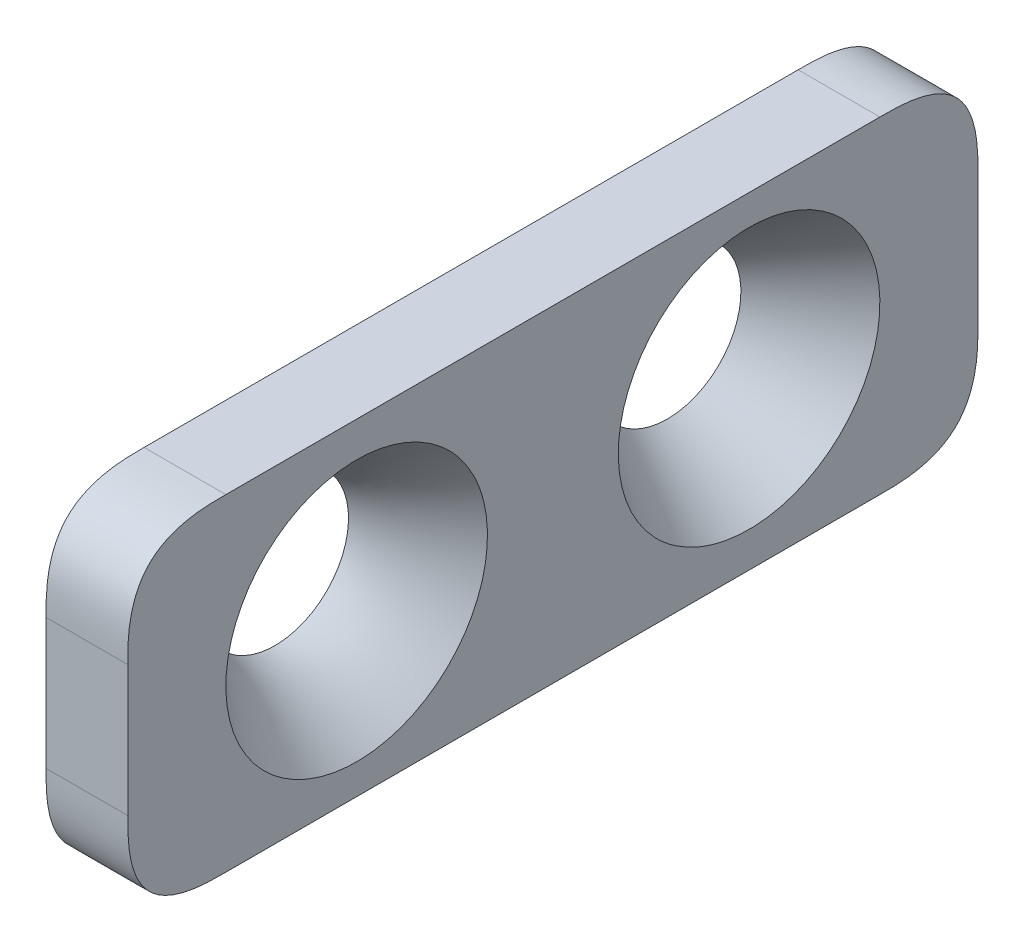
from build123d import *

# Parameters (mm, degrees)
SKETCH1_W           = 26
SKETCH1_H           = 10
BOSS_EXTRUDE1_DEPTH = 2.5
FILLET1_SIZE        = 3
SKETCH4_5_R         = 2.25
SKETCH3_6_R         = 4


with BuildPart() as part:
    # Sketch1 → Boss-Extrude1 (new body)
    with BuildSketch(Plane(origin=(0, 0, 0), x_dir=(0, 0, -1), z_dir=(1, 0, 0))):
        with Locations((13, 5)):
            Rectangle(SKETCH1_W, SKETCH1_H)
    extrude(amount=BOSS_EXTRUDE1_DEPTH)

    # Fillet1
    # a fillet whose section is not a circle: 3 mm, written as the material it takes off along each edge
    with BuildSketch(Plane(origin=(-7.5, 10, 0), x_dir=(0, 0, -1), z_dir=(1, 0, 0)), Plane(origin=(-7.5, 0, -26), x_dir=(0, 0, 1), z_dir=(1, 0, 0)), Plane(origin=(-7.5, 10, -26), x_dir=(0, -1, 0), z_dir=(1, 0, 0))) as fillet1_piece_1:
        with BuildLine():
            add(Edge.make_bspline([(FILLET1_SIZE, 0), (FILLET1_SIZE * 0.831801948466, 0), (FILLET1_SIZE * 0.663603896932, 0), (FILLET1_SIZE * 0.292893218813, -FILLET1_SIZE * 0.0716919198361), (FILLET1_SIZE * 0.0716919198361, -FILLET1_SIZE * 0.292893218813), (0, -FILLET1_SIZE * 0.663603896932), (0, -FILLET1_SIZE * 0.831801948466), (0, -FILLET1_SIZE)], knots=[0, 0, 0, 0, 0, 0, 0.5, 0.5, 1, 1, 1, 1, 1, 1], degree=5))
            Line((0, -FILLET1_SIZE), (0, 0))
            Line((0, 0), (FILLET1_SIZE, 0))
        make_face()
    extrude(amount=17.5, mode=Mode.SUBTRACT)
    with BuildSketch(Plane(origin=(-7.5, 0, 0), x_dir=(0, 0, -1), z_dir=(1, 0, 0))) as fillet1_piece_2:
        with BuildLine():
            add(Edge.make_bspline([(FILLET1_SIZE, 0), (FILLET1_SIZE * 0.831801948466, 0), (FILLET1_SIZE * 0.663603896932, 0), (FILLET1_SIZE * 0.292893218813, FILLET1_SIZE * 0.0716919198361), (FILLET1_SIZE * 0.0716919198361, FILLET1_SIZE * 0.292893218813), (0, FILLET1_SIZE * 0.663603896932), (0, FILLET1_SIZE * 0.831801948466), (0, FILLET1_SIZE)], knots=[0, 0, 0, 0, 0, 0, 0.5, 0.5, 1, 1, 1, 1, 1, 1], degree=5))
            Line((0, FILLET1_SIZE), (0, 0))
            Line((0, 0), (FILLET1_SIZE, 0))
        make_face()
    extrude(amount=17.5, mode=Mode.SUBTRACT)

    # Cut-Loft1: read off the stored shape, not the designer's step
    # Cut-Loft1: loft between two sections, ruled curve by curve
    cut_loft1_from = [
        Edge.make_bspline([(0, 5.227220393, -4.761502537), (0, 5.040678937, -4.742567504), (0, 4.827360743, -4.743831636), (0, 4.355343831, -4.831009815), (0, 4.09562853, -4.918026839), (0, 3.710202489, -5.150291271), (0, 3.582651152, -5.2453356), (0, 3.342613634, -5.469976954), (0, 3.230127455, -5.599573979), (0, 3.033437391, -5.892627716), (0, 2.949592094, -6.055325315), (0, 2.823029016, -6.402187173), (0, 2.780437569, -6.586238152), (0, 2.742567504, -6.959321063), (0, 2.747306812, -7.148176386), (0, 2.801589604, -7.513395142), (0, 2.851032094, -7.68962222), (0, 2.984823778, -8.016221759), (0, 3.068974238, -8.165778536), (0, 3.258976095, -8.434071364), (0, 3.364827492, -8.552807416), (0, 3.695720639, -8.857782374), (0, 3.932653309, -8.995212029), (0, 4.377524958, -9.175459681), (0, 4.586238152, -9.219562431), (0, 4.959321063, -9.257432496), (0, 5.172639257, -9.256168364), (0, 5.644656169, -9.168990185), (0, 5.90437147, -9.081973161), (0, 6.289797511, -8.849708729), (0, 6.417348848, -8.7546644), (0, 6.657386366, -8.530023046), (0, 6.769872545, -8.400426021), (0, 6.966562609, -8.107372284), (0, 7.050407906, -7.944674685), (0, 7.176970984, -7.597812827), (0, 7.219562431, -7.413761848), (0, 7.257432496, -7.040678937), (0, 7.252693188, -6.851823614), (0, 7.198410396, -6.486604858), (0, 7.148967906, -6.31037778), (0, 7.015176222, -5.983778241), (0, 6.931025762, -5.834221464), (0, 6.741023905, -5.565928636), (0, 6.635172508, -5.447192584), (0, 6.304279361, -5.142217626), (0, 6.067346691, -5.004787971), (0, 5.622475042, -4.824540319), (0, 5.413761848, -4.780437569), (0, 5.227220393, -4.761502537)], [0, 0, 0, 0, 0.0625, 0.0625, 0.125, 0.125, 0.15625, 0.15625, 0.1875, 0.1875, 0.21875, 0.21875, 0.25, 0.25, 0.28125, 0.28125, 0.3125, 0.3125, 0.34375, 0.34375, 0.375, 0.375, 0.4375, 0.4375, 0.5, 0.5, 0.5625, 0.5625, 0.625, 0.625, 0.65625, 0.65625, 0.6875, 0.6875, 0.71875, 0.71875, 0.75, 0.75, 0.78125, 0.78125, 0.8125, 0.8125, 0.84375, 0.84375, 0.875, 0.875, 0.9375, 0.9375, 1, 1, 1, 1], 3),
    ]
    cut_loft1_to = [
        Edge.make_bspline([(2.5, 2.811561531, -3.602638399), (2.5, 2.528448064, -3.778586903), (2.5, 2.229585449, -4.012046448), (2.5, 1.65992568, -4.647393225), (2.5, 1.388895654, -5.051936935), (2.5, 1.098683643, -5.797441454), (2.5, 1.021967094, -6.068450115), (2.5, 0.927996054, -6.645321276), (2.5, 0.910956437, -6.951185481), (2.5, 0.952403615, -7.577266038), (2.5, 1.011097599, -7.897318025), (2.5, 1.209685139, -8.522967618), (2.5, 1.349633474, -8.828268581), (2.5, 1.701530482, -9.394495515), (2.5, 1.913312576, -9.655153449), (2.5, 2.386369409, -10.110226694), (2.5, 2.647353909, -10.30455978), (2.5, 3.19037235, -10.618925341), (2.5, 3.472167179, -10.739070815), (2.5, 4.031019985, -10.910226979), (2.5, 4.307984356, -10.961431088), (2.5, 5.104928058, -11.031293352), (2.5, 5.587659325, -10.967391766), (2.5, 6.409558868, -10.737916455), (2.5, 6.75121216, -10.573310105), (2.5, 7.317439093, -10.221413097), (2.5, 7.616301709, -9.987953552), (2.5, 8.185961477, -9.352606775), (2.5, 8.456991504, -8.948063065), (2.5, 8.747203514, -8.202558546), (2.5, 8.823920064, -7.931549885), (2.5, 8.917891104, -7.354678724), (2.5, 8.934930721, -7.048814519), (2.5, 8.893483543, -6.422733962), (2.5, 8.834789558, -6.102681975), (2.5, 8.636202018, -5.477032382), (2.5, 8.496253684, -5.171731419), (2.5, 8.144356676, -4.605504485), (2.5, 7.932574581, -4.344846551), (2.5, 7.459517749, -3.889773306), (2.5, 7.198533248, -3.69544022), (2.5, 6.655514807, -3.381074659), (2.5, 6.373719979, -3.260929185), (2.5, 5.814867172, -3.089773021), (2.5, 5.537902802, -3.038568912), (2.5, 4.7409591, -2.968706648), (2.5, 4.258227833, -3.032608234), (2.5, 3.436328289, -3.262083545), (2.5, 3.094674998, -3.426689895), (2.5, 2.811561531, -3.602638399)], [0, 0, 0, 0, 0.0625, 0.0625, 0.125, 0.125, 0.15625, 0.15625, 0.1875, 0.1875, 0.21875, 0.21875, 0.25, 0.25, 0.28125, 0.28125, 0.3125, 0.3125, 0.34375, 0.34375, 0.375, 0.375, 0.4375, 0.4375, 0.5, 0.5, 0.5625, 0.5625, 0.625, 0.625, 0.65625, 0.65625, 0.6875, 0.6875, 0.71875, 0.71875, 0.75, 0.75, 0.78125, 0.78125, 0.8125, 0.8125, 0.84375, 0.84375, 0.875, 0.875, 0.9375, 0.9375, 1, 1, 1, 1], 3),
    ]
    cut_loft1 = Solid(Shell([*[Face.make_surface_from_curves(cut_loft1_from[k], cut_loft1_to[k]) for k in range(1)], Face(Wire(cut_loft1_from)), Face(Wire(cut_loft1_to))]))
    add(cut_loft1, mode=Mode.SUBTRACT)

    # Sketch4<5> → Cut-Loft2 section 0
    with BuildSketch(Plane.ZY):
        with Locations((-19, 5)):
            Circle(SKETCH4_5_R)
    # Sketch3<6> → Cut-Loft2 section 1
    with BuildSketch(Plane(origin=(2.5, 0, 0), x_dir=(0, 0, -1), z_dir=(1, 0, 0))):
        with Locations((19, 5.077056421)):
            Circle(SKETCH3_6_R)
    loft(mode=Mode.SUBTRACT)


solid = part.part
